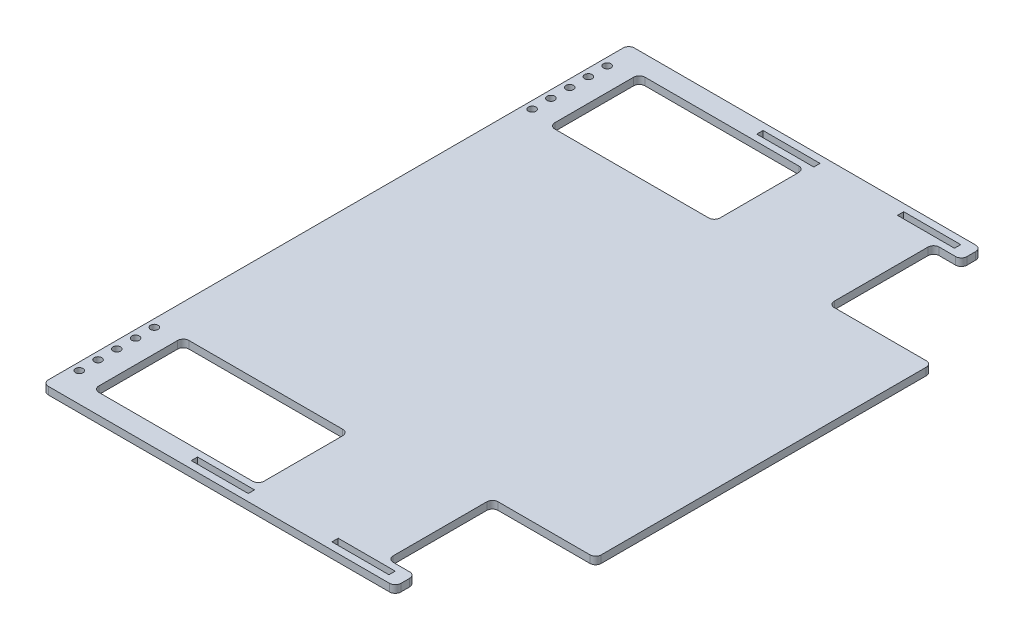
from build123d import *

# Parameters (mm, degrees)
SKETCH1_R           = 2
SKETCH1_W           = 30.4
SKETCH1_H           = 3.35
SKETCH1_W_2         = 88
SKETCH1_H_2         = 48
BOSS_EXTRUDE1_DEPTH = 4
FILLET1_R           = 3


with BuildPart() as part:
    # Sketch1 → Boss-Extrude1 (new body)
    with BuildSketch(Plane(origin=(0, 0, 0), x_dir=(1, 0, 0), z_dir=(0, 1, 0))):
        Polygon((-100, 156.215), (-100, -156.215), (87.95, -156.215), (87.95, -145.555), (73.17, -145.555), (73.17, -89.625), (128.17, -89.625), (128.17, 89.625), (73.17, 89.625), (73.17, 145.555), (87.95, 145.555), (87.95, 156.215), align=None)
        with Locations((-96, 140.715)):
            Circle(SKETCH1_R, mode=Mode.SUBTRACT)
        with Locations((-96, 130.715)):
            Circle(SKETCH1_R, mode=Mode.SUBTRACT)
        with Locations((-96, 120.715)):
            Circle(SKETCH1_R, mode=Mode.SUBTRACT)
        with Locations((-96, 110.715)):
            Circle(SKETCH1_R, mode=Mode.SUBTRACT)
        with Locations((-96, 100.715)):
            Circle(SKETCH1_R, mode=Mode.SUBTRACT)
        with Locations((-96, -100.715)):
            Circle(SKETCH1_R, mode=Mode.SUBTRACT)
        with Locations((-96, -110.715)):
            Circle(SKETCH1_R, mode=Mode.SUBTRACT)
        with Locations((-96, -120.715)):
            Circle(SKETCH1_R, mode=Mode.SUBTRACT)
        with Locations((-96, -130.715)):
            Circle(SKETCH1_R, mode=Mode.SUBTRACT)
        with Locations((-96, -140.715)):
            Circle(SKETCH1_R, mode=Mode.SUBTRACT)
        with Locations((65.59, 150.74)):
            Rectangle(SKETCH1_W, SKETCH1_H, mode=Mode.SUBTRACT)
        with Locations((-39.71, 121.555)):
            Rectangle(SKETCH1_W_2, SKETCH1_H_2, mode=Mode.SUBTRACT)
        with Locations((-9.41, 150.74)):
            Rectangle(SKETCH1_W, SKETCH1_H, mode=Mode.SUBTRACT)
        with Locations((65.59, -150.74)):
            Rectangle(SKETCH1_W, SKETCH1_H, mode=Mode.SUBTRACT)
        with Locations((-9.41, -150.74)):
            Rectangle(SKETCH1_W, SKETCH1_H, mode=Mode.SUBTRACT)
        with Locations((-39.71, -121.555)):
            Rectangle(SKETCH1_W_2, SKETCH1_H_2, mode=Mode.SUBTRACT)
    extrude(amount=BOSS_EXTRUDE1_DEPTH)

    # Fillet1
    fillet1_edges = [part.edges().sort_by_distance(p)[0] for p in [
        (-100, 2, 156.215),
        (4.29, 2, 97.555),
        (4.29, 2, 145.555),
        (-83.71, 2, 145.555),
        (-83.71, 2, 97.555),
        (87.95, 2, 156.215),
        (87.95, 2, 145.555),
        (73.17, 2, 145.555),
        (73.17, 2, 89.625),
        (128.17, 2, 89.625),
        (-100, 2, -156.215),
        (4.29, 2, -97.555),
        (4.29, 2, -145.555),
        (-83.71, 2, -145.555),
        (-83.71, 2, -97.555),
        (128.17, 2, -89.625),
        (73.17, 2, -89.625),
        (73.17, 2, -145.555),
        (87.95, 2, -156.215),
        (87.95, 2, -145.555),
    ]]
    fillet(fillet1_edges, radius=FILLET1_R)


solid = part.part
